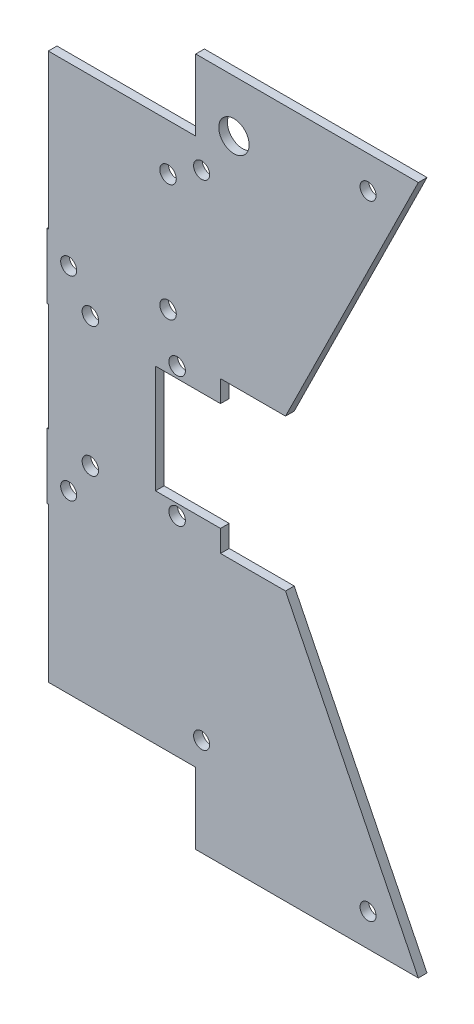
from build123d import *

# Parameters (mm, degrees)
SKETCH1_R           = 2.3495
SKETCH1_R_2         = 4.445
BOSS_EXTRUDE1_DEPTH = 2.54
SKETCH2_R           = 2.413
CUT_EXTRUDE1_DEPTH  = 217.884748371
SKETCH3_W           = 19.05
SKETCH3_H           = 31.623
CUT_EXTRUDE2_DEPTH  = 217.884748371
SKETCH4_W           = 12.77569874
SKETCH4_H           = 24.435209008
SKETCH4_W_2         = 40.233428475
SKETCH4_H_2         = 28.333759116
CUT_EXTRUDE3_DEPTH  = 217.884748371
SKETCH5_R           = 2.413
CUT_EXTRUDE4_DEPTH  = 217.884748371


with BuildPart() as part:
    # Sketch1 → Boss-Extrude1 (new body)
    with BuildSketch(Plane.XY):
        Polygon((-2.930050059, -104.509781075), (-3.314938219, -104.509781075), (-3.314938219, -110.859781075), (-3.314938219, -123.559781075), (-2.930050059, -123.559781075), (-2.930050059, -168.708281075), (38.709428475, -168.708281075), (38.709428475, -189.536281075), (105.397061781, -189.536281075), (66.517436481, -110.859781075), (47.485061781, -110.859781075), (47.485061781, -104.509781075), (47.485061781, -72.886781075), (47.485061781, -66.536781075), (66.517436481, -66.536781075), (105.397061781, 12.139718925), (38.709428475, 12.139718925), (38.709428475, -8.688281075), (-2.930050059, -8.688281075), (-2.930050059, -53.836781075), (-3.314938219, -53.836781075), (-3.314938219, -66.536781075), (-3.314938219, -72.886781075), (-2.930050059, -72.886781075), align=None)
        with Locations((90.673911143, 2.614718925)):
            Circle(SKETCH1_R, mode=Mode.SUBTRACT)
        with Locations((41.95655448, -16.435281075)):
            Circle(SKETCH1_R, mode=Mode.SUBTRACT)
        with Locations((3.035061781, -60.186781075)):
            Circle(SKETCH1_R, mode=Mode.SUBTRACT)
        with Locations((3.035061781, -117.209781075)):
            Circle(SKETCH1_R, mode=Mode.SUBTRACT)
        with Locations((41.95655448, -160.961281075)):
            Circle(SKETCH1_R, mode=Mode.SUBTRACT)
        with Locations((90.673911143, -180.011281075)):
            Circle(SKETCH1_R, mode=Mode.SUBTRACT)
        with Locations((51.409428475, -3.100281075)):
            Circle(SKETCH1_R_2, mode=Mode.SUBTRACT)
    extrude(amount=BOSS_EXTRUDE1_DEPTH)

    # Sketch2 → Cut-Extrude1 (cut, through all)
    with BuildSketch(Plane.XY.offset(2.54)):
        with Locations((9.385061781, -69.711781075)):
            Circle(SKETCH2_R)
        with Locations((34.785061781, -69.711781075)):
            Circle(SKETCH2_R)
        with Locations((34.785061781, -107.684781075)):
            Circle(SKETCH2_R)
        with Locations((9.385061781, -107.684781075)):
            Circle(SKETCH2_R)
    extrude(amount=-CUT_EXTRUDE1_DEPTH, mode=Mode.SUBTRACT)

    # Sketch3 → Cut-Extrude2 (cut, through all)
    with BuildSketch(Plane.XY.offset(2.54)):
        with Locations((37.960061781, -88.698281075)):
            Rectangle(SKETCH3_W, SKETCH3_H)
    extrude(amount=-CUT_EXTRUDE2_DEPTH, mode=Mode.SUBTRACT)

    # Sketch4 → Cut-Extrude3 (cut, through all)
    with BuildSketch(Plane.XY.offset(2.54)):
        with Locations((33.845579105, 3.529323429)):
            Rectangle(SKETCH4_W, SKETCH4_H)
        with Locations((20.116714238, -182.875160633)):
            Rectangle(SKETCH4_W_2, SKETCH4_H_2)
    extrude(amount=-CUT_EXTRUDE3_DEPTH, mode=Mode.SUBTRACT)

    # Sketch5 → Cut-Extrude4 (cut, through all)
    with BuildSketch(Plane(origin=(0, 0, 0), x_dir=(-1, 0, 0), z_dir=(0, 0, -1))):
        with Locations((-32.121949941, -22.404281075)):
            Circle(SKETCH5_R)
        with Locations((-32.121949941, -56.694281075)):
            Circle(SKETCH5_R)
    extrude(amount=-CUT_EXTRUDE4_DEPTH, mode=Mode.SUBTRACT)


solid = part.part
